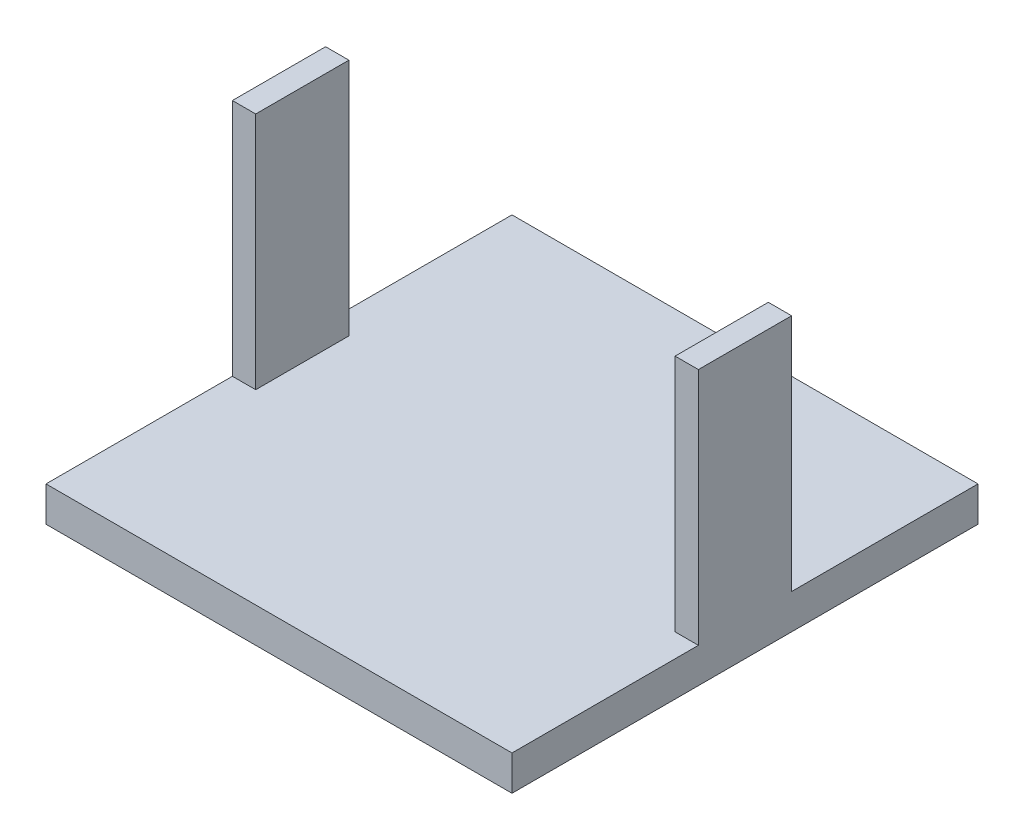
from build123d import *

# Parameters (mm, degrees)
ESBO_O1_W                = 20
ESBO_O1_H                = 400
RESSALTO_EXTRUS_O1_DEPTH = 205
ESBO_O1_3_W              = 360
ESBO_O1_3_H              = 400
RESSALTO_EXTRUS_O2_DEPTH = 30
ESBO_O1_4_W              = 20
ESBO_O1_4_H              = 400
RESSALTO_EXTRUS_O3_DEPTH = 205
ESBO_O2_W                = 20
ESBO_O2_H                = 400
RESSALTO_EXTRUS_O4_DEPTH = 30
ESBO_O3_W                = 20
ESBO_O3_H                = 400
RESSALTO_EXTRUS_O5_DEPTH = 30
ESBO_O4_W                = 20
ESBO_O4_H                = 160
CORTE_EXTRUS_O1_DEPTH    = 205
ESBO_O5_W                = 20
ESBO_O5_H                = 160
CORTE_EXTRUS_O2_DEPTH    = 205


with BuildPart() as part:
    # Esboço1 → Ressalto-extrusão1 (new body)
    with BuildSketch(Plane(origin=(0, 0, 0), x_dir=(1, 0, 0), z_dir=(0, 1, 0))):
        with Locations((10, 200)):
            Rectangle(ESBO_O1_W, ESBO_O1_H)
    extrude(amount=RESSALTO_EXTRUS_O1_DEPTH)

    # Esboço1<3> → Ressalto-extrusão2 (add)
    with BuildSketch(Plane(origin=(0, 0, 0), x_dir=(1, 0, 0), z_dir=(0, 1, 0))):
        with Locations((200, 200)):
            Rectangle(ESBO_O1_3_W, ESBO_O1_3_H)
    extrude(amount=RESSALTO_EXTRUS_O2_DEPTH)

    # Esboço1<4> → Ressalto-extrusão3 (add)
    with BuildSketch(Plane(origin=(0, 0, 0), x_dir=(1, 0, 0), z_dir=(0, 1, 0))):
        with Locations((390, 200)):
            Rectangle(ESBO_O1_4_W, ESBO_O1_4_H)
    extrude(amount=RESSALTO_EXTRUS_O3_DEPTH)

    # Esboço2 → Ressalto-extrusão4 (add)
    with BuildSketch(Plane(origin=(0, 205, 0), x_dir=(1, 0, 0), z_dir=(0, 1, 0))):
        with Locations((10, 200)):
            Rectangle(ESBO_O2_W, ESBO_O2_H)
    extrude(amount=RESSALTO_EXTRUS_O4_DEPTH)

    # Esboço3 → Ressalto-extrusão5 (add)
    with BuildSketch(Plane(origin=(0, 205, 0), x_dir=(1, 0, 0), z_dir=(0, 1, 0))):
        with Locations((390, 200)):
            Rectangle(ESBO_O3_W, ESBO_O3_H)
    extrude(amount=RESSALTO_EXTRUS_O5_DEPTH)

    # Esboço4 → Corte-extrusão1 (cut)
    with BuildSketch(Plane(origin=(0, 235, 0), x_dir=(1, 0, 0), z_dir=(0, 1, 0))):
        with Locations((10, 320)):
            Rectangle(ESBO_O4_W, ESBO_O4_H)
        with Locations((10, 80)):
            Rectangle(ESBO_O4_W, ESBO_O4_H)
    extrude(amount=-CORTE_EXTRUS_O1_DEPTH, mode=Mode.SUBTRACT)

    # Esboço5 → Corte-extrusão2 (cut)
    with BuildSketch(Plane(origin=(0, 235, 0), x_dir=(1, 0, 0), z_dir=(0, 1, 0))):
        with Locations((390, 320)):
            Rectangle(ESBO_O5_W, ESBO_O5_H)
        with Locations((390, 80)):
            Rectangle(ESBO_O5_W, ESBO_O5_H)
    extrude(amount=-CORTE_EXTRUS_O2_DEPTH, mode=Mode.SUBTRACT)


solid = part.part
